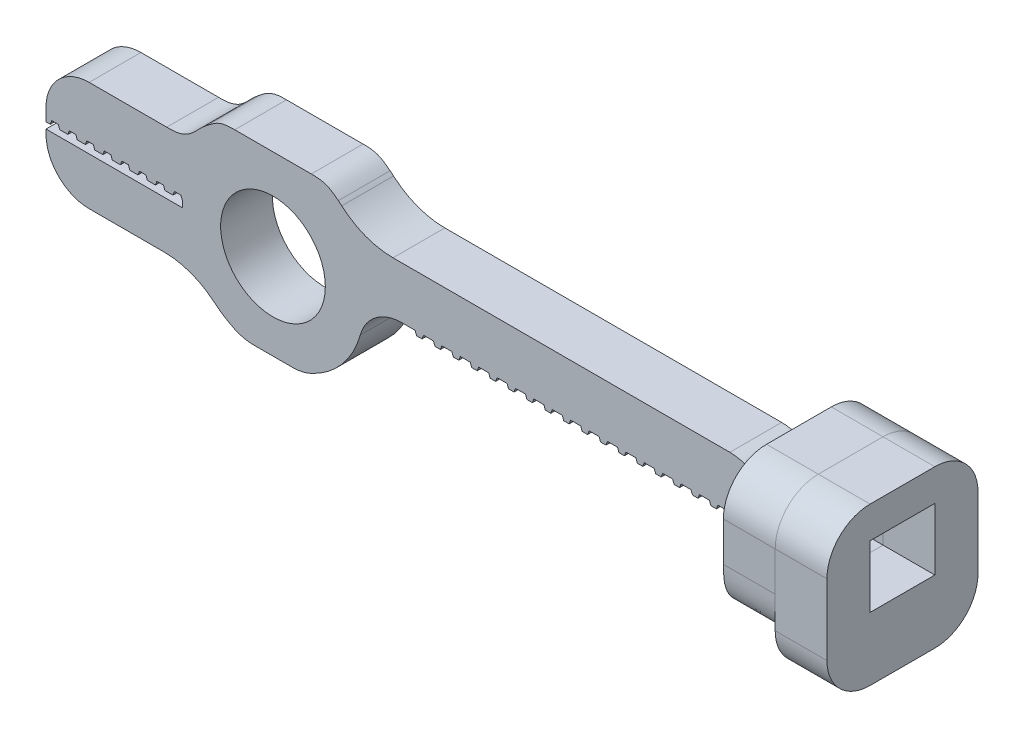
from build123d import *

# Parameters (mm, degrees)
SKETCH1_R      = 6.065
EXTRUDE1_DEPTH = 6
FILLET2_DEPTH  = 6
FILLET3_START  = -1
FILLET3_DEPTH  = 8
FILLET4_START  = -1
FILLET4_DEPTH  = 8
FILLET5_R      = 5
FILLET6_R      = 9
SKETCH2_W      = 17.5
SKETCH2_H      = 14.55
SKETCH2_W_2    = 7.5
SKETCH2_H_2    = 7.19
EXTRUDE2_DEPTH = 6
FILLET7_R      = 5
FILLET8_SIZE   = 5
FILLET9_SIZE   = 5
SKETCH4_W      = 7.5
SKETCH4_H      = 7.19
EXTRUDE4_DEPTH = 6
FILLET10_R     = 5
FILLET11_R     = 5


with BuildPart() as part:
    # Sketch1 → Extrude1 (new body)
    with BuildSketch(Plane.XY):
        with BuildLine():
            Line((-10.493826757, -0.36), (-26.298679372, -0.36))
            Line((-26.298679372, -0.36), (-26.298679372, -5.86))
            Line((-26.298679372, -5.86), (-8.712657459, -5.86))
            ThreePointArc((-8.712657459, -5.86), (-6.306509101, -8.395114232), (-3.201562119, -10))
            Line((-3.201562119, -10), (3.201562119, -10))
            ThreePointArc((3.201562119, -10), (8.71675784, -5.853898936), (10.467931983, 0.82))
            Line((10.467931983, 0.82), (16.467931983, 0.82))
            Line((16.467931983, 0.82), (16.635358291, 0.36))
            Line((16.635358291, 0.36), (17.270505675, 0.36))
            Line((17.270505675, 0.36), (17.437931983, 0.82))
            Line((17.437931983, 0.82), (18.599431983, 0.82))
            Line((18.599431983, 0.82), (18.766858291, 0.36))
            Line((18.766858291, 0.36), (19.402005675, 0.36))
            Line((19.402005675, 0.36), (19.569431983, 0.82))
            Line((19.569431983, 0.82), (20.730931983, 0.82))
            Line((20.730931983, 0.82), (20.898358291, 0.36))
            Line((20.898358291, 0.36), (21.533505675, 0.36))
            Line((21.533505675, 0.36), (21.700931983, 0.82))
            Line((21.700931983, 0.82), (22.862431983, 0.82))
            Line((22.862431983, 0.82), (23.029858291, 0.36))
            Line((23.029858291, 0.36), (23.665005675, 0.36))
            Line((23.665005675, 0.36), (23.832431983, 0.82))
            Line((23.832431983, 0.82), (24.993931983, 0.82))
            Line((24.993931983, 0.82), (25.161358291, 0.36))
            Line((25.161358291, 0.36), (25.796505675, 0.36))
            Line((25.796505675, 0.36), (25.963931983, 0.82))
            Line((25.963931983, 0.82), (27.125431983, 0.82))
            Line((27.125431983, 0.82), (27.292858291, 0.36))
            Line((27.292858291, 0.36), (27.928005675, 0.36))
            Line((27.928005675, 0.36), (28.095431983, 0.82))
            Line((28.095431983, 0.82), (29.256931983, 0.82))
            Line((29.256931983, 0.82), (29.424358291, 0.36))
            Line((29.424358291, 0.36), (30.059505675, 0.36))
            Line((30.059505675, 0.36), (30.226931983, 0.82))
            Line((30.226931983, 0.82), (31.388431983, 0.82))
            Line((31.388431983, 0.82), (31.555858291, 0.36))
            Line((31.555858291, 0.36), (32.191005675, 0.36))
            Line((32.191005675, 0.36), (32.358431983, 0.82))
            Line((32.358431983, 0.82), (33.519931983, 0.82))
            Line((33.519931983, 0.82), (33.687358291, 0.36))
            Line((33.687358291, 0.36), (34.322505675, 0.36))
            Line((34.322505675, 0.36), (34.489931983, 0.82))
            Line((34.489931983, 0.82), (35.651431983, 0.82))
            Line((35.651431983, 0.82), (35.818858291, 0.36))
            Line((35.818858291, 0.36), (36.454005675, 0.36))
            Line((36.454005675, 0.36), (36.621431983, 0.82))
            Line((36.621431983, 0.82), (37.782931983, 0.82))
            Line((37.782931983, 0.82), (37.950358291, 0.36))
            Line((37.950358291, 0.36), (38.585505675, 0.36))
            Line((38.585505675, 0.36), (38.752931983, 0.82))
            Line((38.752931983, 0.82), (39.914431983, 0.82))
            Line((39.914431983, 0.82), (40.081858291, 0.36))
            Line((40.081858291, 0.36), (40.717005675, 0.36))
            Line((40.717005675, 0.36), (40.884431983, 0.82))
            Line((40.884431983, 0.82), (42.045931983, 0.82))
            Line((42.045931983, 0.82), (42.213358291, 0.36))
            Line((42.213358291, 0.36), (42.848505675, 0.36))
            Line((42.848505675, 0.36), (43.015931983, 0.82))
            Line((43.015931983, 0.82), (44.177431983, 0.82))
            Line((44.177431983, 0.82), (44.344858291, 0.36))
            Line((44.344858291, 0.36), (44.980005675, 0.36))
            Line((44.980005675, 0.36), (45.147431983, 0.82))
            Line((45.147431983, 0.82), (46.308931983, 0.82))
            Line((46.308931983, 0.82), (46.476358291, 0.36))
            Line((46.476358291, 0.36), (47.111505675, 0.36))
            Line((47.111505675, 0.36), (47.278931983, 0.82))
            Line((47.278931983, 0.82), (48.440431983, 0.82))
            Line((48.440431983, 0.82), (48.607858291, 0.36))
            Line((48.607858291, 0.36), (49.243005675, 0.36))
            Line((49.243005675, 0.36), (49.410431983, 0.82))
            Line((49.410431983, 0.82), (50.571931983, 0.82))
            Line((50.571931983, 0.82), (50.739358291, 0.36))
            Line((50.739358291, 0.36), (51.374505675, 0.36))
            Line((51.374505675, 0.36), (51.541931983, 0.82))
            Line((51.541931983, 0.82), (52.703431983, 0.82))
            Line((52.703431983, 0.82), (52.870858291, 0.36))
            Line((52.870858291, 0.36), (53.506005675, 0.36))
            Line((53.506005675, 0.36), (53.673431983, 0.82))
            Line((53.673431983, 0.82), (54.834931983, 0.82))
            Line((54.834931983, 0.82), (55.002358291, 0.36))
            Line((55.002358291, 0.36), (55.637505675, 0.36))
            Line((55.637505675, 0.36), (55.804931983, 0.82))
            Line((55.804931983, 0.82), (56.966431983, 0.82))
            Line((56.966431983, 0.82), (57.133858291, 0.36))
            Line((57.133858291, 0.36), (57.769005675, 0.36))
            Line((57.769005675, 0.36), (57.936431983, 0.82))
            Line((57.936431983, 0.82), (57.936431983, 6.82))
            Line((57.936431983, 6.82), (9.952478335, 6.82))
            ThreePointArc((9.952478335, 6.82), (8.15774469, 8.889062187), (5.942577303, 10.5))
            Line((5.942577303, 10.5), (-5.942577303, 10.5))
            ThreePointArc((-5.942577303, 10.5), (-8.15774469, 8.889062187), (-9.952478335, 6.82))
            Line((-9.952478335, 6.82), (-26.298679372, 6.82))
            Line((-26.298679372, 6.82), (-26.298679372, 0.36))
            Line((-26.298679372, 0.36), (-25.798679372, 0.36))
            Line((-25.798679372, 0.36), (-25.631253064, 0.82))
            Line((-25.631253064, 0.82), (-24.871253064, 0.82))
            Line((-24.871253064, 0.82), (-24.703826757, 0.36))
            Line((-24.703826757, 0.36), (-23.768679372, 0.36))
            Line((-23.768679372, 0.36), (-23.601253064, 0.82))
            Line((-23.601253064, 0.82), (-22.841253064, 0.82))
            Line((-22.841253064, 0.82), (-22.673826757, 0.36))
            Line((-22.673826757, 0.36), (-21.738679372, 0.36))
            Line((-21.738679372, 0.36), (-21.571253064, 0.82))
            Line((-21.571253064, 0.82), (-20.811253064, 0.82))
            Line((-20.811253064, 0.82), (-20.643826757, 0.36))
            Line((-20.643826757, 0.36), (-19.708679372, 0.36))
            Line((-19.708679372, 0.36), (-19.541253064, 0.82))
            Line((-19.541253064, 0.82), (-18.781253064, 0.82))
            Line((-18.781253064, 0.82), (-18.613826757, 0.36))
            Line((-18.613826757, 0.36), (-17.678679372, 0.36))
            Line((-17.678679372, 0.36), (-17.511253064, 0.82))
            Line((-17.511253064, 0.82), (-16.751253064, 0.82))
            Line((-16.751253064, 0.82), (-16.583826757, 0.36))
            Line((-16.583826757, 0.36), (-15.648679372, 0.36))
            Line((-15.648679372, 0.36), (-15.481253064, 0.82))
            Line((-15.481253064, 0.82), (-14.721253064, 0.82))
            Line((-14.721253064, 0.82), (-14.553826757, 0.36))
            Line((-14.553826757, 0.36), (-13.618679372, 0.36))
            Line((-13.618679372, 0.36), (-13.451253064, 0.82))
            Line((-13.451253064, 0.82), (-12.691253064, 0.82))
            Line((-12.691253064, 0.82), (-12.523826757, 0.36))
            Line((-12.523826757, 0.36), (-11.588679372, 0.36))
            Line((-11.588679372, 0.36), (-11.421253064, 0.82))
            Line((-11.421253064, 0.82), (-10.661253064, 0.82))
            Line((-10.661253064, 0.82), (-10.493826757, 0.36))
            Line((-10.493826757, 0.36), (-10.493826757, -0.36))
        make_face()
        Circle(SKETCH1_R, mode=Mode.SUBTRACT)
    extrude(amount=EXTRUDE1_DEPTH)

    # Fillet2: read off the stored shape, not the designer's step
    # Fillet2 outline → Fillet2 (add)
    with BuildSketch(Plane.XY):
        with BuildLine():
            add(Edge.make_bspline(
                [(-12.30860776, 6.82), (-11.919108735, 6.82), (-11.52960971, 6.82), (-10.688362326, 6.891410392), (-9.892211542, 7.20666659), (-9.175783314, 7.847026424), (-8.932986904, 8.116463035), (-8.702218144, 8.356771169)],
                knots=[0, 0, 0, 0, 0, 0, 0.5, 0.5, 1, 1, 1, 1, 1, 1], degree=5))
            Line((-12.30860776, 6.82), (-9.952478335, 6.82))
            ThreePointArc((-9.952478335, 6.82), (-9.35894447, 7.614091109), (-8.702218144, 8.356771169))
        make_face()
    extrude(amount=FILLET2_DEPTH)

    # Fillet3: read off the stored shape, not the designer's step
    # Fillet3 outline → Fillet3 (cut)
    with BuildSketch(Plane.XY.offset(FILLET3_START)):
        with BuildLine():
            Line((3, 10.5), (4.434436266, 10.5))
            add(Edge.make_bspline(
                [(4.434436266, 10.5), (4.759474434, 10.5), (5.084512601, 10.5), (5.829579536, 10.443931897), (6.468104214, 10.209741168), (7.011187199, 9.828881322), (7.300205983, 9.612168516), (7.572749264, 9.392427459)],
                knots=[0, 0, 0, 0, 0, 0, 0.5, 0.5, 1, 1, 1, 1, 1, 1], degree=5))
            ThreePointArc((7.572749264, 9.392427459), (7.78846806, 9.214336128), (8, 9.031291435))
            Line((8, 9.031291435), (8, 12))
            Line((8, 12), (3, 12))
            Line((3, 12), (3, 10.5))
        make_face()
    extrude(amount=FILLET3_DEPTH, mode=Mode.SUBTRACT)

    # Fillet4: read off the stored shape, not the designer's step
    # Fillet4 outline → Fillet4 (cut)
    with BuildSketch(Plane.XY.offset(FILLET4_START)):
        with BuildLine():
            ThreePointArc((-8, 9.031291435), (-7.78846806, 9.214336128), (-7.572749264, 9.392427459))
            add(Edge.make_bspline(
                [(-7.572749264, 9.392427459), (-7.300205983, 9.612168516), (-7.011187199, 9.828881323), (-6.468104214, 10.209741168), (-5.829579536, 10.443931897), (-5.084512601, 10.5), (-4.759474434, 10.5), (-4.434436266, 10.5)],
                knots=[0, 0, 0, 0, 0, 0, 0.5, 0.5, 1, 1, 1, 1, 1, 1], degree=5))
            Line((-4.434436266, 10.5), (-3, 10.5))
            Line((-3, 10.5), (-3, 12))
            Line((-3, 12), (-8, 12))
            Line((-8, 12), (-8, 9.031291435))
        make_face()
    extrude(amount=FILLET4_DEPTH, mode=Mode.SUBTRACT)

    # Fillet5
    fillet5_edges = [part.edges().sort_by_distance(p)[0] for p in [
        (3.201562119, -10, 3),
        (-3.201562119, -10, 3),
    ]]
    fillet(fillet5_edges, radius=FILLET5_R)

    # Fillet6
    fillet6_edges = [part.edges().sort_by_distance(p)[0] for p in [
        (9.952478335, 6.82, 3),
        (-8.712657459, -5.86, 3),
    ]]
    fillet(fillet6_edges, radius=FILLET6_R)

    # Fillet11
    fillet11_edges = [part.edges().sort_by_distance(p)[0] for p in [
        (10.467931983, 0.82, 3),
        (-26.298679372, -5.86, 3),
        (-26.298679372, 6.82, 3),
        (57.936431983, 6.82, 3),
    ]]
    fillet(fillet11_edges, radius=FILLET11_R)


with BuildPart() as body_2:
    # Sketch2 → Extrude2 (new body)
    with BuildSketch(Plane(origin=(57.936431983, 0, 0), x_dir=(0, 0, -1), z_dir=(1, 0, 0))):
        with Locations((-3, 3.225)):
            Rectangle(SKETCH2_W, SKETCH2_H)
        with Locations((-3, 3.225)):
            Rectangle(SKETCH2_W_2, SKETCH2_H_2, mode=Mode.SUBTRACT)
    extrude(amount=EXTRUDE2_DEPTH)

    # Fillet7
    fillet7_edges = [body_2.edges().sort_by_distance(p)[0] for p in [
        (60.936431983, 10.5, 11.75),
        (60.936431983, 10.5, -5.75),
    ]]
    fillet(fillet7_edges, radius=FILLET7_R)

    # Fillet8
    # a fillet whose section is not a circle: 5 mm, written as the material it takes off along each edge
    with BuildSketch(Plane(origin=(45.436431983, -4.05, 11.75), x_dir=(0, 1, 0), z_dir=(1, 0, 0))) as fillet8_piece_1:
        with BuildLine():
            add(Edge.make_bspline([(FILLET8_SIZE, 0), (FILLET8_SIZE * 0.831801948466, 0), (FILLET8_SIZE * 0.663603896932, 0), (FILLET8_SIZE * 0.292893218813, -FILLET8_SIZE * 0.0716919198361), (FILLET8_SIZE * 0.0716919198361, -FILLET8_SIZE * 0.292893218813), (0, -FILLET8_SIZE * 0.663603896932), (0, -FILLET8_SIZE * 0.831801948466), (0, -FILLET8_SIZE)], knots=[0, 0, 0, 0, 0, 0, 0.5, 0.5, 1, 1, 1, 1, 1, 1], degree=5))
            Line((0, -FILLET8_SIZE), (0, 0))
            Line((0, 0), (FILLET8_SIZE, 0))
        make_face()
    extrude(amount=31, mode=Mode.SUBTRACT)

    # Fillet9
    # a fillet whose section is not a circle: 5 mm, written as the material it takes off along each edge
    with BuildSketch(Plane(origin=(45.436431983, -4.05, -5.75), x_dir=(0, 0, 1), z_dir=(1, 0, 0))) as fillet9_piece_1:
        with BuildLine():
            add(Edge.make_bspline([(FILLET9_SIZE, 0), (FILLET9_SIZE * 0.831801948466, 0), (FILLET9_SIZE * 0.663603896932, 0), (FILLET9_SIZE * 0.292893218813, -FILLET9_SIZE * 0.0716919198361), (FILLET9_SIZE * 0.0716919198361, -FILLET9_SIZE * 0.292893218813), (0, -FILLET9_SIZE * 0.663603896932), (0, -FILLET9_SIZE * 0.831801948466), (0, -FILLET9_SIZE)], knots=[0, 0, 0, 0, 0, 0, 0.5, 0.5, 1, 1, 1, 1, 1, 1], degree=5))
            Line((0, -FILLET9_SIZE), (0, 0))
            Line((0, 0), (FILLET9_SIZE, 0))
        make_face()
    extrude(amount=31, mode=Mode.SUBTRACT)


with BuildPart() as body_3:
    # Sketch4 → Extrude4 (new body)
    with BuildSketch(Plane(origin=(63.936431983, 0, 0), x_dir=(0, 0, -1), z_dir=(1, 0, 0))):
        with BuildLine():
            Line((-6.75, 10.5), (0.75, 10.5))
            ThreePointArc((0.75, 10.5), (4.285533906, 9.035533906), (5.75, 5.5))
            Line((5.75, 5.5), (5.75, -7.707743543))
            Line((5.75, -7.707743543), (-11.75, -7.707743543))
            Line((-11.75, -7.707743543), (-11.75, 5.5))
            ThreePointArc((-11.75, 5.5), (-10.285533906, 9.035533906), (-6.75, 10.5))
        make_face()
        with Locations((-3, 3.225)):
            Rectangle(SKETCH4_W, SKETCH4_H, mode=Mode.SUBTRACT)
    extrude(amount=EXTRUDE4_DEPTH)

    # Fillet10
    fillet10_edges = [body_3.edges().sort_by_distance(p)[0] for p in [
        (66.936431983, -7.707743543, -5.75),
        (66.936431983, -7.707743543, 11.75),
    ]]
    fillet(fillet10_edges, radius=FILLET10_R)


solid = Compound([part.part, body_2.part, body_3.part])
